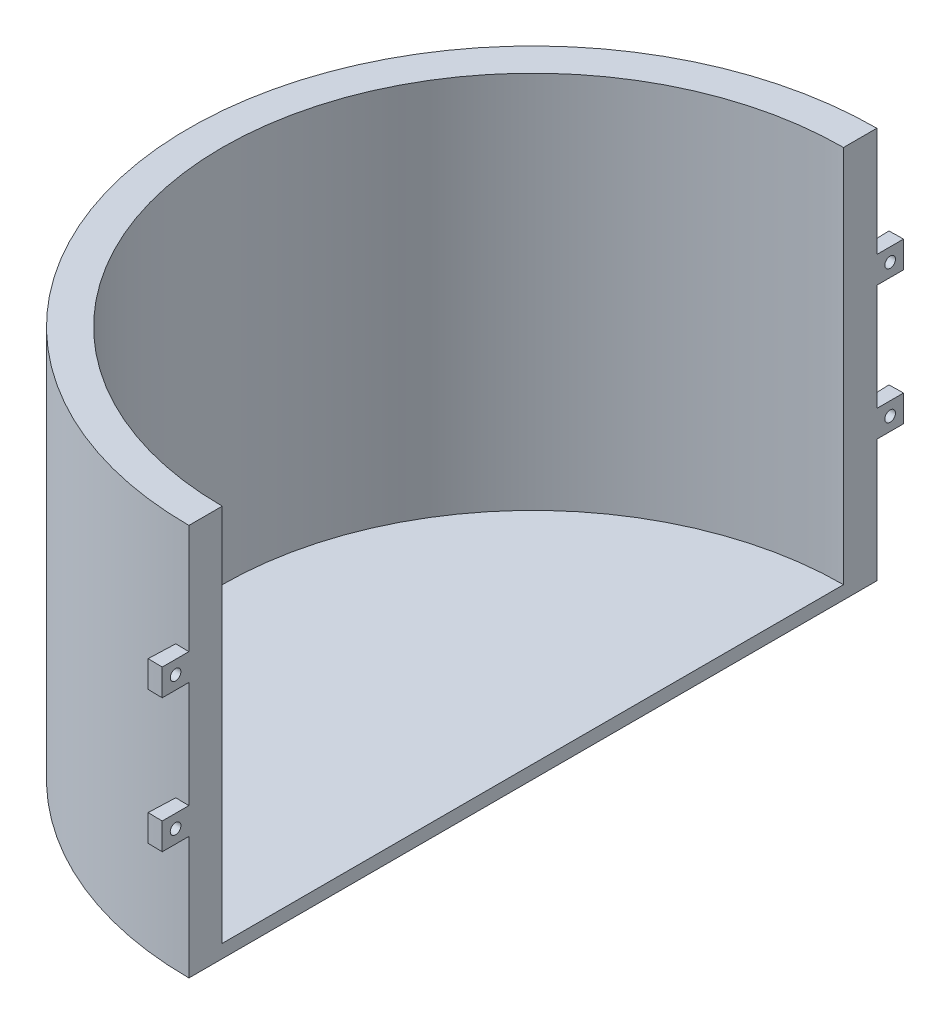
from build123d import *

# Parameters (mm, degrees)
BOSS_EXTRUDE1_DEPTH      = 180
SKETCH3_W                = 116.5
SKETCH3_H                = 142
CUT_REVOLVE1_ANGLE       = 271
WRAP1_SECTION_W          = 10
WRAP1_SECTION_H          = 10
WRAP1_ANGLE              = 2.220766648
WRAP1_SECTOR_2_SECTION_W = 10
WRAP1_SECTOR_2_SECTION_H = 10
WRAP1_SECTOR_2_ANGLE     = 2.220766648
MIRROR1_START            = 60
MIRROR1_DEPTH            = 10
MIRROR1_START_2          = 110
MIRROR1_2_DEPTH          = 10
CUT_EXTRUDE6_DEPTH       = 262.461278204
CUT_EXTRUDE6_DEPTH_BACK  = 20
SKETCH17_R               = 2
CUT_EXTRUDE7_DEPTH       = 10
CUT_EXTRUDE9_DEPTH       = 262.461278204
CUT_EXTRUDE9_DEPTH_BACK  = 262.461278204
SKETCH19_W               = 258
SKETCH19_H               = 15.225908702
CUT_EXTRUDE10_DEPTH      = 252.222015682
CUT_EXTRUDE10_DEPTH_BACK = 252.222015682
SKETCH22_W               = 258
SKETCH22_H               = 14
SKETCH22_H_2             = 3.774091298


# Read off the part's stored shape, not the designer's step: Mirror1
with BuildPart() as part:
    # Sketch1 → Boss-Extrude1 (new body)
    with BuildSketch(Plane(origin=(0, 0, 0), x_dir=(1, 0, 0), z_dir=(0, 1, 0))):
        with BuildLine():
            Line((0, -129), (0, 129))
            ThreePointArc((0, 129), (-129, 0), (0, -129))
        make_face()
    extrude(amount=BOSS_EXTRUDE1_DEPTH)

    # Sketch3 → Cut-Revolve1 (revolve, cut)
    with BuildSketch(Plane(origin=(0, 0, 0), x_dir=(0, 0, -1), z_dir=(1, 0, 0))):
        with Locations((-58.25, 90)):
            Rectangle(SKETCH3_W, SKETCH3_H)
    revolve(axis=Axis((0, 180, 0), (0, -1, 0)), revolution_arc=CUT_REVOLVE1_ANGLE, mode=Mode.SUBTRACT)

    # Wrap1 section (on wrap section) → Wrap1 (revolve)
    with BuildSketch(Plane(origin=(0, 0, 0), x_dir=(0, 0, 1), z_dir=(1, 0, 0))):
        with Locations((134, -115)):
            Rectangle(WRAP1_SECTION_W, WRAP1_SECTION_H)
    revolve(axis=Axis((0, 0, 0), (0, -1, 0)), revolution_arc=WRAP1_ANGLE)

    # Wrap1 sector 2 section (on wrap section) → Wrap1 sector 2 (revolve)
    with BuildSketch(Plane(origin=(0, 0, 0), x_dir=(0, 0, 1), z_dir=(1, 0, 0))):
        with Locations((134, -65)):
            Rectangle(WRAP1_SECTOR_2_SECTION_W, WRAP1_SECTOR_2_SECTION_H)
    revolve(axis=Axis((0, 0, 0), (0, -1, 0)), revolution_arc=WRAP1_SECTOR_2_ANGLE)

    # Mirror1 outline → Mirror1 (add)
    with BuildSketch(Plane(origin=(0, 0, 0), x_dir=(1, 0, 0), z_dir=(0, 1, 0)).offset(MIRROR1_START)):
        with BuildLine():
            ThreePointArc((0, 139), (-2.693629831, 138.973898119), (-5.386248024, 138.895602278))
            Line((-5.386248024, 138.895602278), (-4.998748166, 128.903112906))
            ThreePointArc((-4.998748166, 128.903112906), (-2.499843512, 128.975775952), (0, 129))
            Line((0, 129), (0, 139))
        make_face()
    extrude(amount=MIRROR1_DEPTH)

    # Mirror1 2 outline → Mirror1 2 (add)
    with BuildSketch(Plane(origin=(0, 0, 0), x_dir=(1, 0, 0), z_dir=(0, 1, 0)).offset(MIRROR1_START_2)):
        with BuildLine():
            ThreePointArc((0, 139), (-2.693629831, 138.973898119), (-5.386248024, 138.895602278))
            Line((-5.386248024, 138.895602278), (-4.998748166, 128.903112906))
            ThreePointArc((-4.998748166, 128.903112906), (-2.499843512, 128.975775952), (0, 129))
            Line((0, 129), (0, 139))
        make_face()
    extrude(amount=MIRROR1_2_DEPTH)

    # Sketch16 → Cut-Extrude6 (cut, two sides: drawn at the far end of the back side and taken through both)
    with BuildSketch(Plane(origin=(0, 180, 0), x_dir=(1, 0, 0), z_dir=(0, 1, 0)).offset(-CUT_EXTRUDE6_DEPTH_BACK)):
        with BuildLine():
            Line((0, 100), (0, -100))
            ThreePointArc((0, -100), (-100, 0), (0, 100))
        make_face()
    extrude(amount=CUT_EXTRUDE6_DEPTH + CUT_EXTRUDE6_DEPTH_BACK, mode=Mode.SUBTRACT)

    # Sketch17 → Cut-Extrude7 (cut)
    with BuildSketch(Plane(origin=(0, 0, 0), x_dir=(0, 0, -1), z_dir=(1, 0, 0))):
        with Locations((-134, 115)):
            Circle(SKETCH17_R)
        with Locations((-134, 65)):
            Circle(SKETCH17_R)
        with Locations(Location((134, 115, 0), (0, 0, 180))):
            Circle(SKETCH17_R)
        with Locations((134, 65)):
            Circle(SKETCH17_R)
    extrude(amount=-CUT_EXTRUDE7_DEPTH, mode=Mode.SUBTRACT)

    # Sketch19 → Cut-Extrude9 (cut, two sides: drawn at the far end of the back side and taken through both)
    with BuildSketch(Plane(origin=(0, 0, 0), x_dir=(0, 0, -1), z_dir=(1, 0, 0)).offset(-CUT_EXTRUDE9_DEPTH_BACK)):
        with Locations((0, 172.387045649)):
            Rectangle(SKETCH19_W, SKETCH19_H)
    extrude(amount=CUT_EXTRUDE9_DEPTH + CUT_EXTRUDE9_DEPTH_BACK, mode=Mode.SUBTRACT)

    # Sketch22 → Cut-Extrude10 (cut, two sides: drawn at the far end of the back side and taken through both)
    with BuildSketch(Plane(origin=(0, 0, 0), x_dir=(0, 0, -1), z_dir=(1, 0, 0)).offset(-CUT_EXTRUDE10_DEPTH_BACK)):
        with Locations((0, 7)):
            Rectangle(SKETCH22_W, SKETCH22_H)
        with Locations((0, 162.887045649)):
            Rectangle(SKETCH22_W, SKETCH22_H_2)
    extrude(amount=CUT_EXTRUDE10_DEPTH + CUT_EXTRUDE10_DEPTH_BACK, mode=Mode.SUBTRACT)


solid = part.part
